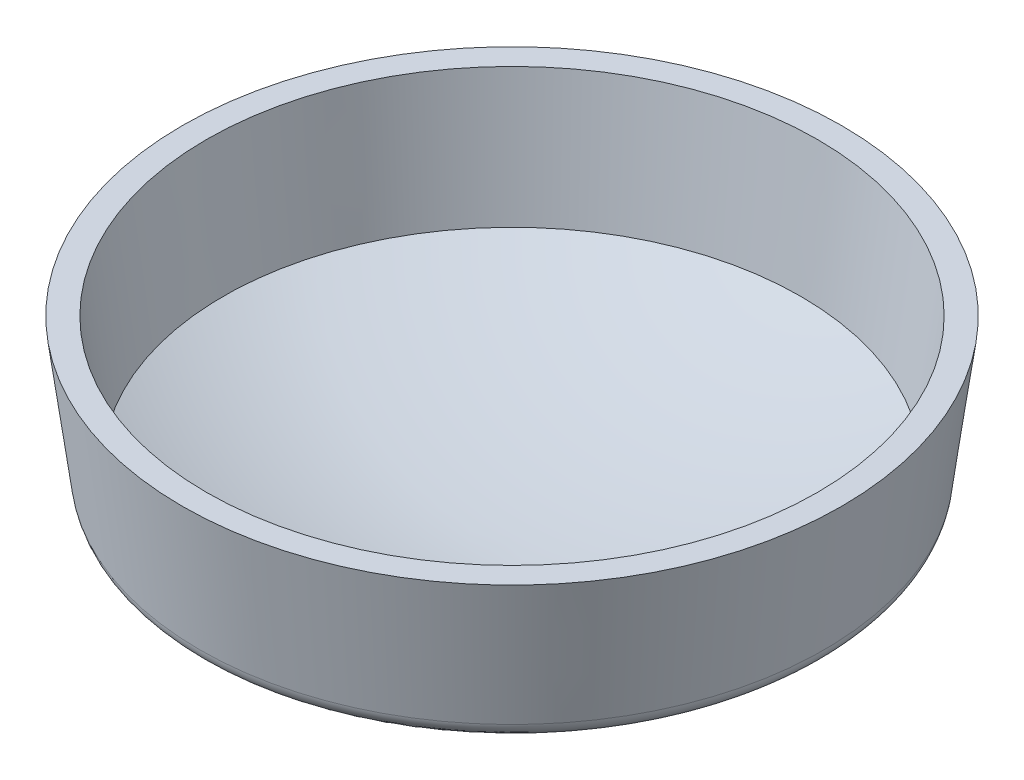
from build123d import *

# Parameters (mm, degrees)
DOME1_FACE_RADIUS = 41.275
DOME1_HEIGHT      = 9.525
FILLET1_R         = 2.54


# Read off the part's stored shape, not the designer's step: Shell1
with BuildPart() as part:
    # Sketch1 → Revolve1 (revolve)
    with BuildSketch(Plane(origin=(0, 0, 0), x_dir=(0, 0, -1), z_dir=(1, 0, 0)), mode=Mode.PRIVATE) as revolve1_sk:
        Polygon((0, 0), (41.275, 0), (43.78974535, 19.05), (0, 19.05), align=None)
    revolve(revolve1_sk.sketch.rotate(Axis((0, 0, 0), (0, -1, 0)), 180), axis=Axis((0, 0, 0), (0, -1, 0)))

    # Dome1: a dome of height H over a round flat face of radius A is a cap of a sphere of radius (A * A + H * H) / (2 * H)
    dome1_r = (DOME1_FACE_RADIUS * DOME1_FACE_RADIUS + DOME1_HEIGHT * DOME1_HEIGHT) / (2 * DOME1_HEIGHT)
    dome1_base = Plane((0, 0, 0), z_dir=(0, -1, 0))
    with Locations(dome1_base.offset(DOME1_HEIGHT - dome1_r)):
        dome1_ball = Sphere(dome1_r, mode=Mode.PRIVATE)
    add(split(dome1_ball, bisect_by=dome1_base, keep=Keep.TOP, mode=Mode.PRIVATE))

    # Fillet1
    fillet1_edges = [part.edges().sort_by_distance(p)[0] for p in [
        (41.275, 0, 0),
    ]]
    fillet(fillet1_edges, radius=FILLET1_R)

    # Shell1 outline → Shell1 (revolve, cut)
    with BuildSketch(Plane.XY):
        with BuildLine():
            Line((0, 19.05), (0, -6.35))
            ThreePointArc((0, -6.35), (19.639142672, -4.205925769), (38.353009101, 2.125281265))
            Line((38.353009101, 2.125281265), (40.587201031, 19.05))
            Line((40.587201031, 19.05), (0, 19.05))
        make_face()
    revolve(axis=Axis((0, 0, 0), (0, 1, 0)), mode=Mode.SUBTRACT)


solid = part.part
